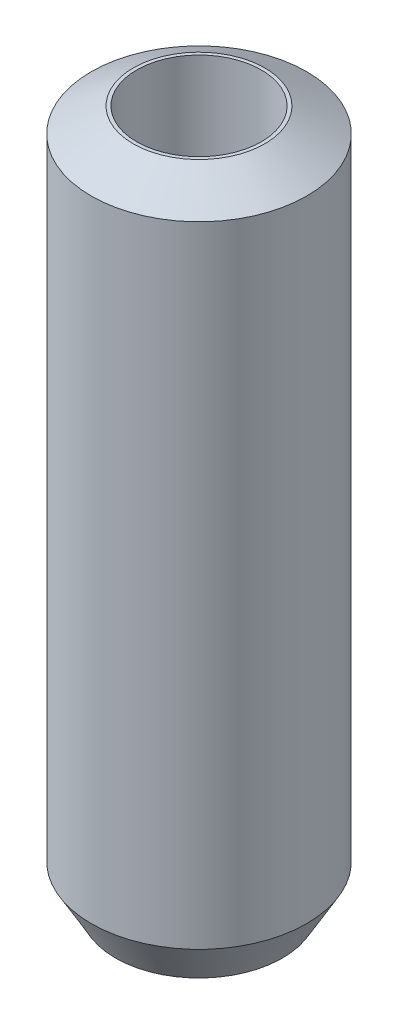
from build123d import *
from OCP.BRepFilletAPI import BRepFilletAPI_MakeChamfer

# Parameters (mm, degrees)
SKETCH1_R           = 12.5
BOSS_EXTRUDE1_DEPTH = 80.794224886
SKETCH2_R           = 7.230571039
CUT_EXTRUDE1_DEPTH  = 83.705542589
CHAMFER1_SIZE       = 2.811428568
CHAMFER1_SIZE2      = 4.869537121


with BuildPart() as part:
    # Sketch1 → Boss-Extrude1 (new body)
    with BuildSketch(Plane(origin=(0, 0, 0), x_dir=(1, 0, 0), z_dir=(0, 1, 0))):
        Circle(SKETCH1_R)
    extrude(amount=BOSS_EXTRUDE1_DEPTH)

    # Sketch2 → Cut-Extrude1 (cut, through all)
    with BuildSketch(Plane(origin=(0, 0, 0), x_dir=(1, 0, 0), z_dir=(0, 1, 0))):
        Circle(SKETCH2_R)
    extrude(amount=CUT_EXTRUDE1_DEPTH, mode=Mode.SUBTRACT)

    # Chamfer1: one chamfer whose edges measure the first distance from different faces: ONE call of the kernel's chamfer builder (chamfer() names one face for all edges)
    chamfer1_edges_1 = [part.edges().sort_by_distance(p)[0] for p in [
        (-12.5, 80.794224886, 0),
    ]]
    chamfer1_side_1 = [part.faces().sort_by_distance(p)[0] for p in [
        (-12.5, 40.397112443, 0),
    ]]
    chamfer1_edges_2 = [part.edges().sort_by_distance(p)[0] for p in [
        (-12.5, 0, 0),
    ]]
    chamfer1_side_2 = [part.faces().sort_by_distance(p)[0] for p in [
        (-12.146446609, 0, 0),
    ]]
    chamfer1 = BRepFilletAPI_MakeChamfer(part.part.solid().wrapped)
    for e in chamfer1_edges_1:
        chamfer1.Add(CHAMFER1_SIZE, CHAMFER1_SIZE2, e.wrapped, chamfer1_side_1[0].wrapped)  # the first distance lies on this face
    for e in chamfer1_edges_2:
        chamfer1.Add(CHAMFER1_SIZE, CHAMFER1_SIZE2, e.wrapped, chamfer1_side_2[0].wrapped)  # the first distance lies on this face
    add(Compound.cast(chamfer1.Shape()), mode=Mode.REPLACE)


solid = part.part
